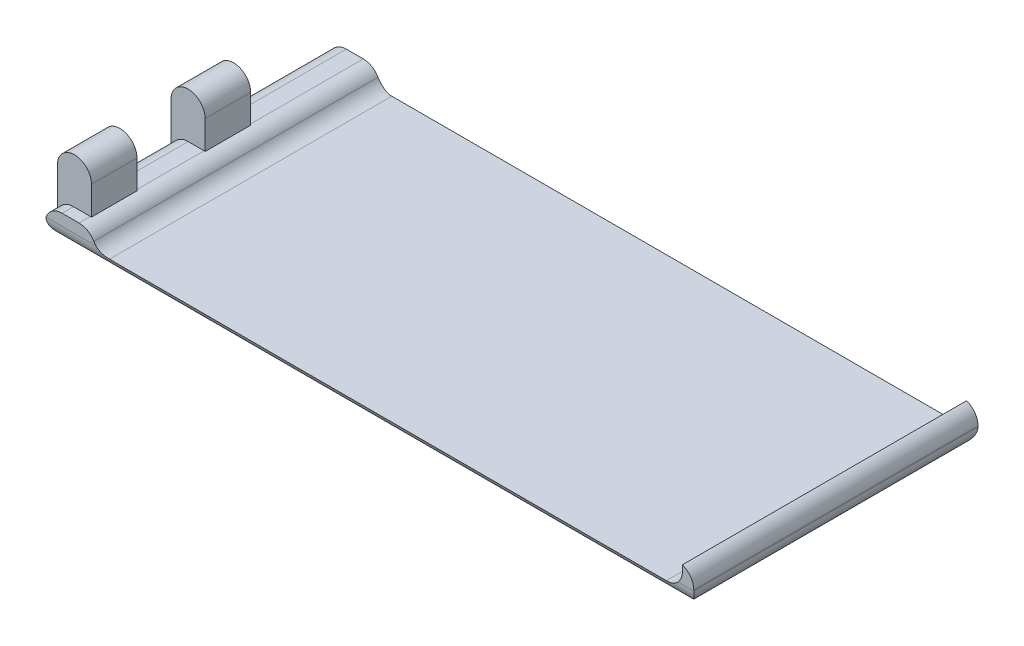
from build123d import *

# Parameters (mm, degrees)
SKETCH1_W                     = 113.95
SKETCH1_H                     = 50
BOSS_EXTRUDE1_DEPTH           = 2
SKETCH2_W                     = 8
SKETCH2_H                     = 50
BOSS_EXTRUDE2_DEPTH           = 3
SKETCH3_W                     = 2
SKETCH3_H                     = 50
BOSS_EXTRUDE3_DEPTH           = 4
SKETCH7_W                     = 6
SKETCH7_H                     = 8
BOSS_EXTRUDE5_DEPTH           = 8
FILLET1_RADIUS                = 3
FILLET1_LENGTH                = 8
SKETCH10_R                    = 1.525
CUT_EXTRUDE2_DEPTH            = 2
LPATTERN2_COUNT               = 2
LPATTERN2_PITCH               = 20
FILLET1_OF_LPATTERN2_2_RADIUS = 3
FILLET1_OF_LPATTERN2_2_LENGTH = 8
FILLET2_R                     = 3
FILLET3_R                     = 3
FILLET4_START                 = -25
FILLET4_DEPTH                 = 20
FILLET4_START_2               = 3
FILLET4_2_DEPTH               = 12
FILLET4_START_3               = -19.719
FILLET4_3_DEPTH               = 44.719
FILLET4_START_4               = 23
FILLET4_4_DEPTH               = 2
FILLET5_R                     = 3


with BuildPart() as part:
    # Sketch1 → Boss-Extrude1 (new body)
    with BuildSketch(Plane(origin=(0, 0, 0), x_dir=(1, 0, 0), z_dir=(0, 1, 0))):
        Rectangle(SKETCH1_W, SKETCH1_H)
    extrude(amount=BOSS_EXTRUDE1_DEPTH)

    # Sketch2 → Boss-Extrude2 (add)
    with BuildSketch(Plane(origin=(0, 2, 0), x_dir=(1, 0, 0), z_dir=(0, 1, 0))):
        with Locations((-52.975, 0)):
            Rectangle(SKETCH2_W, SKETCH2_H)
    extrude(amount=BOSS_EXTRUDE2_DEPTH)

    # Sketch3 → Boss-Extrude3 (add)
    with BuildSketch(Plane(origin=(0, 2, 0), x_dir=(1, 0, 0), z_dir=(0, 1, 0))):
        with Locations((55.975, 0)):
            Rectangle(SKETCH3_W, SKETCH3_H)
    extrude(amount=BOSS_EXTRUDE3_DEPTH)

    # Sketch7 → Boss-Extrude5 (add)
    with BuildSketch(Plane(origin=(0, 5, 0), x_dir=(1, 0, 0), z_dir=(0, 1, 0))):
        with Locations((-53.975, 1)):
            Rectangle(SKETCH7_W, SKETCH7_H)
    boss_extrude5 = extrude(amount=BOSS_EXTRUDE5_DEPTH)

    # Fillet1: full round fillet: the end face becomes a half cylinder, R = half its width
    fillet1_face = Plane((-53.975, 13, -1), x_dir=(0, 0, 1), z_dir=(0, 1, 0))  # on the end face: x along it, z out of the body
    fillet1_slab = fillet1_face.offset(-FILLET1_RADIUS / 2) * Box(FILLET1_LENGTH, 2 * FILLET1_RADIUS, FILLET1_RADIUS, mode=Mode.PRIVATE)  # the body's end, R deep
    fillet1_round = Plane((-53.975, 10, -1), x_dir=(0, 1, 0), z_dir=(0, 0, 1)) * Cylinder(FILLET1_RADIUS, FILLET1_LENGTH, mode=Mode.PRIVATE)  # its axis R under the face
    add(fillet1_slab - fillet1_round, mode=Mode.SUBTRACT)

    # Sketch10 → Cut-Extrude2 (cut)
    with BuildSketch(Plane(origin=(0, 0, -5), x_dir=(-1, 0, 0), z_dir=(0, 0, -1))):
        with Locations((53.975, 10)):
            Circle(SKETCH10_R)
    cut_extrude2 = extrude(amount=-CUT_EXTRUDE2_DEPTH, mode=Mode.SUBTRACT)

    # LPattern2: Boss-Extrude5, Cut-Extrude2 ×2
    with Locations(*[(0, 0, i * LPATTERN2_PITCH) for i in range(1, LPATTERN2_COUNT)]):
        add(boss_extrude5)
        add(cut_extrude2, mode=Mode.SUBTRACT)

    # Fillet1 of LPattern2 2: full round fillet: the end face becomes a half cylinder, R = half its width
    fillet1_of_lpattern2_2_face = Plane((-53.975, 13, 19), x_dir=(0, 0, 1), z_dir=(0, 1, 0))  # on the end face: x along it, z out of the body
    fillet1_of_lpattern2_2_slab = fillet1_of_lpattern2_2_face.offset(-FILLET1_OF_LPATTERN2_2_RADIUS / 2) * Box(FILLET1_OF_LPATTERN2_2_LENGTH, 2 * FILLET1_OF_LPATTERN2_2_RADIUS, FILLET1_OF_LPATTERN2_2_RADIUS, mode=Mode.PRIVATE)  # the body's end, R deep
    fillet1_of_lpattern2_2_round = Plane((-53.975, 10, 19), x_dir=(0, 1, 0), z_dir=(0, 0, 1)) * Cylinder(FILLET1_OF_LPATTERN2_2_RADIUS, FILLET1_OF_LPATTERN2_2_LENGTH, mode=Mode.PRIVATE)  # its axis R under the face
    add(fillet1_of_lpattern2_2_slab - fillet1_of_lpattern2_2_round, mode=Mode.SUBTRACT)

    # Fillet2
    # the kernel refuses this fillet: 3 mm, written as the material it takes off along each edge
    with BuildSketch(Plane(origin=(-64.475, 0, -25), x_dir=(0, 1, 0), z_dir=(1, 0, 0))) as fillet2_piece_1:
        with BuildLine():
            CenterArc((FILLET2_R, FILLET2_R), FILLET2_R, 180, 90)
            Line((0, FILLET2_R), (0, 0))
            Line((0, 0), (FILLET2_R, 0))
        make_face()
    extrude(amount=128.95, mode=Mode.SUBTRACT)
    with BuildSketch(Plane(origin=(-56.975, 0, 32.5), x_dir=(1, 0, 0), z_dir=(0, 0, -1)), Plane(origin=(56.975, 0, -32.5), x_dir=(-1, 0, 0), z_dir=(0, 0, 1))) as fillet2_piece_2:
        with BuildLine():
            CenterArc((FILLET2_R, -FILLET2_R), FILLET2_R, 90, 90)
            Line((0, -FILLET2_R), (0, 0))
            Line((0, 0), (FILLET2_R, 0))
        make_face()
    extrude(amount=65, mode=Mode.SUBTRACT)
    with BuildSketch(Plane(origin=(64.475, 0, 25), x_dir=(0, 0, -1), z_dir=(-1, 0, 0))) as fillet2_piece_3:
        with BuildLine():
            CenterArc((FILLET2_R, -FILLET2_R), FILLET2_R, 90, 90)
            Line((0, -FILLET2_R), (0, 0))
            Line((0, 0), (FILLET2_R, 0))
        make_face()
    extrude(amount=128.95, mode=Mode.SUBTRACT)

    # Fillet3
    fillet3_edges = [part.edges().sort_by_distance(p)[0] for p in [
        (-48.975, 2, 0),
        (54.975, 2, 0),
    ]]
    fillet(fillet3_edges, radius=FILLET3_R - 0.0001)  # a hair under: the kernel refuses the full size

    # Fillet4: read off the stored shape, not the designer's step
    # Fillet4 outline → Fillet4 (cut)
    with BuildSketch(Plane.XY.offset(FILLET4_START)):
        with BuildLine():
            ThreePointArc((-51.171152423, 5), (-49.671152423, 4.598076211), (-48.573076211, 3.5))
            ThreePointArc((-48.573076211, 3.5), (-48.872777479, 4.223542864), (-48.975, 5))
            Line((-48.975, 5), (-51.171152423, 5))
        make_face()
        with BuildLine():
            ThreePointArc((-56.975, 3), (-55.878623683, 4.449489743), (-54.146572875, 5))
            Line((-54.146572875, 5), (-56.975, 5))
            Line((-56.975, 5), (-56.975, 3))
        make_face()
    extrude(amount=FILLET4_DEPTH, mode=Mode.SUBTRACT)

    # Fillet4 2 outline → Fillet4 2 (cut)
    with BuildSketch(Plane.XY.offset(FILLET4_START_2)):
        with BuildLine():
            Line((-53.975, 5), (-56.975, 5))
            Line((-56.975, 5), (-56.975, 3))
            ThreePointArc((-56.975, 3), (-56.964491568, 2.749121219), (-56.933039892, 2.5))
            ThreePointArc((-56.933039892, 2.5), (-55.911491673, 4.291287847), (-53.975, 5))
        make_face()
        with BuildLine():
            ThreePointArc((-51.171152423, 5), (-49.671152423, 4.598076211), (-48.573076211, 3.5))
            ThreePointArc((-48.573076211, 3.5), (-48.872777479, 4.223542864), (-48.975, 5))
            Line((-48.975, 5), (-51.171152423, 5))
        make_face()
    extrude(amount=FILLET4_2_DEPTH, mode=Mode.SUBTRACT)

    # Fillet4 3 outline → Fillet4 3 (cut)
    with BuildSketch(Plane.XY.offset(FILLET4_START_3)):
        with BuildLine():
            Line((-50.975, 5), (-50.975, 4.993580503))
            ThreePointArc((-50.975, 4.993580503), (-49.58697311, 4.547621617), (-48.573076211, 3.5))
            ThreePointArc((-48.573076211, 3.5), (-48.872777479, 4.223542864), (-48.975, 5))
            Line((-48.975, 5), (-50.975, 5))
        make_face()
    extrude(amount=FILLET4_3_DEPTH, mode=Mode.SUBTRACT)

    # Fillet4 4 outline → Fillet4 4 (cut)
    with BuildSketch(Plane.XY.offset(FILLET4_START_4)):
        with BuildLine():
            Line((-50.975, 5), (-51.171152423, 5))
            ThreePointArc((-51.171152423, 5), (-51.073023703, 4.998394696), (-50.975, 4.993580503))
            Line((-50.975, 4.993580503), (-50.975, 5))
        make_face()
        with BuildLine():
            ThreePointArc((-56.975, 3), (-55.878623683, 4.449489743), (-54.146572875, 5))
            Line((-54.146572875, 5), (-56.975, 5))
            Line((-56.975, 5), (-56.975, 3))
        make_face()
    extrude(amount=FILLET4_4_DEPTH, mode=Mode.SUBTRACT)

    # Fillet5
    # the kernel refuses this fillet: 3 mm, written as the material it takes off along each edge
    with BuildSketch(Plane(origin=(56.975, 6, 32.071067812), x_dir=(0, -1, 0), z_dir=(0, 0, -1))) as fillet5_piece_1:
        with BuildLine():
            CenterArc((2.828427125, 3), FILLET5_R, 199.471220634, 70.528779366)
            Line((0, 2), (-0.056568542, 1.98))
            ThreePointArc((-0.056568542, 1.98), (-0.06, 1), (-0.06, 0))
            Line((-0.06, 0), (0, -0.06))
            Line((0, -0.06), (2.828427125, -0.06))
            Line((2.828427125, -0.06), (2.828427125, 0))
        make_face()
    extrude(amount=64.142135624, mode=Mode.SUBTRACT)


solid = part.part
